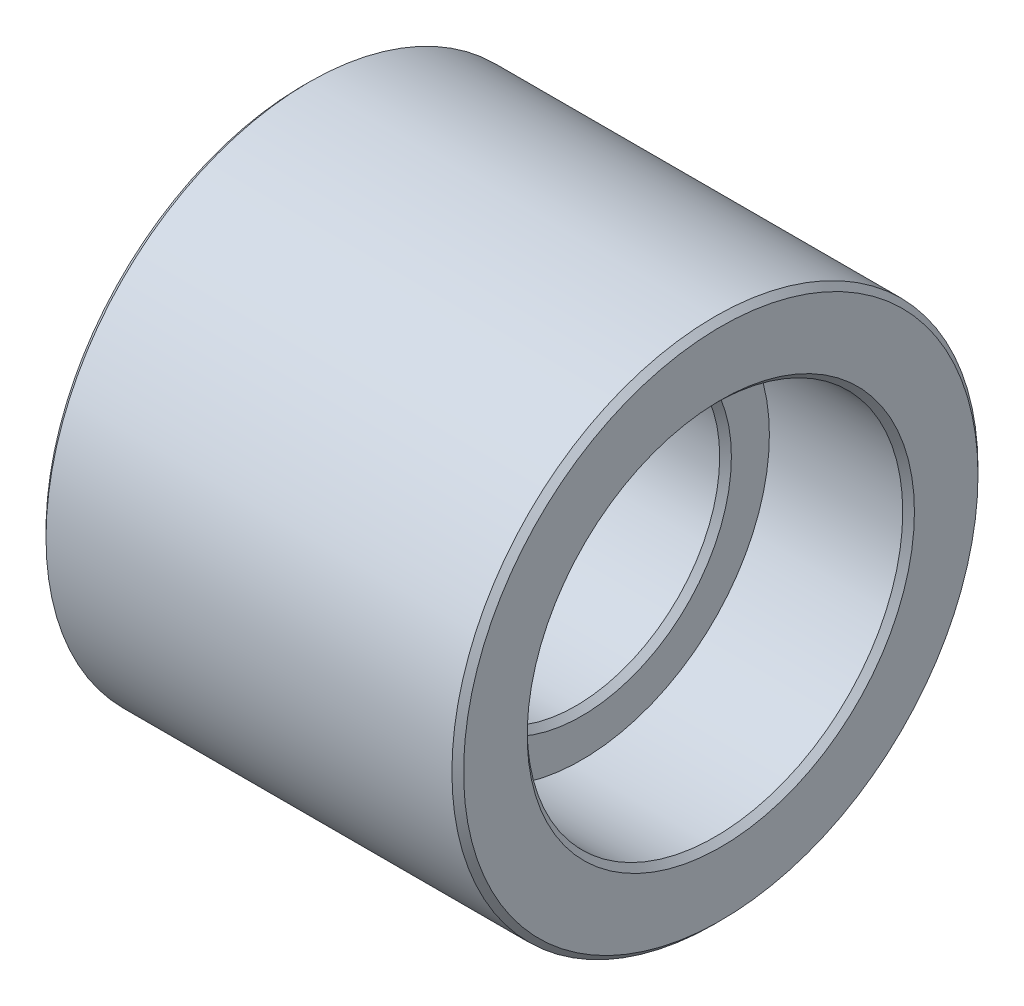
from build123d import *

# Parameters (mm, degrees)
CHAMFER1_SIZE = 0.2


with BuildPart() as part:
    # Sketch1 → Revolve1 (revolve)
    with BuildSketch(Plane(origin=(0, 0, 0), x_dir=(1, 0, 0), z_dir=(0, 1, 0))):
        Polygon((7.14375, 9), (-7.14375, 9), (-7.14375, 6.425), (-2.38125, 6.425), (-2.38125, 4.925), (2.38125, 4.925), (2.38125, 6.425), (7.14375, 6.425), align=None)
    revolve(axis=Axis((0, 0, 0), (1, 0, 0)))

    # Chamfer1
    chamfer1_edges = [part.edges().sort_by_distance(p)[0] for p in [
        (7.14375, 0, 9),
        (-7.14375, 0, 9),
        (-7.14375, 0, 6.425),
        (-2.38125, 0, 4.925),
        (2.38125, 0, 4.925),
        (7.14375, 0, 6.425),
    ]]
    chamfer(chamfer1_edges, length=CHAMFER1_SIZE)


solid = part.part
